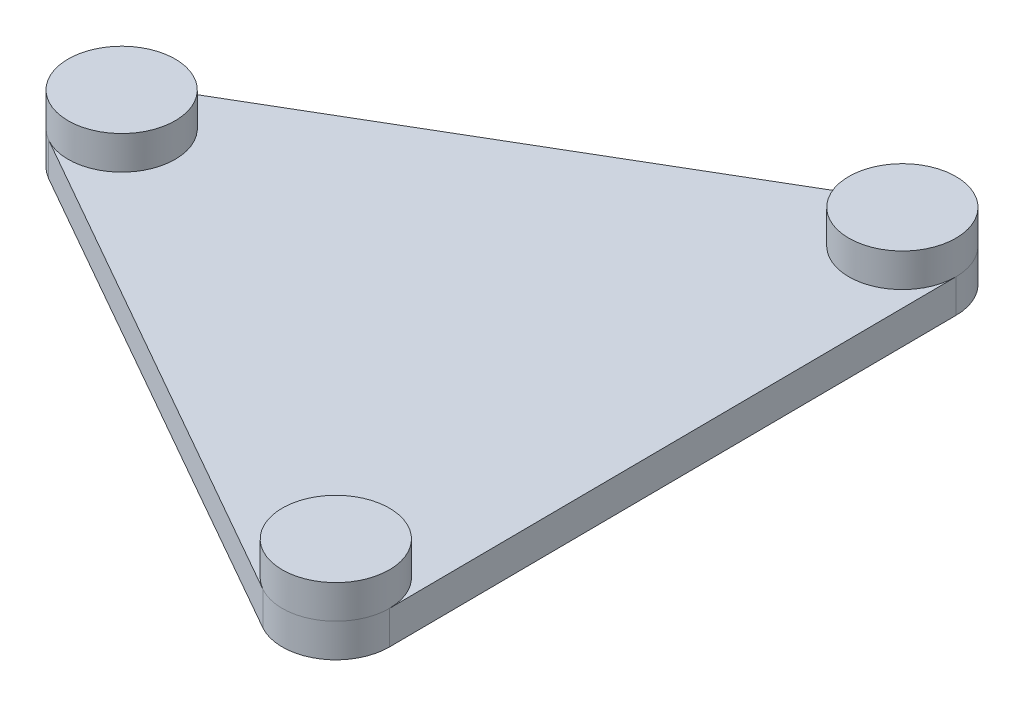
from build123d import *

# Parameters (mm, degrees)
BOSS_EXTRUDE1_DEPTH = 6.35
SKETCH2_R           = 10.16
BOSS_EXTRUDE2_DEPTH = 6.35
FILLET1_R           = 10.16


with BuildPart() as part:
    # Sketch1 → Boss-Extrude1 (new body)
    with BuildSketch(Plane(origin=(0, 0, 0), x_dir=(1, 0, 0), z_dir=(0, 1, 0))):
        Polygon((40.933013594, 72.038381655), (-82.853575358, -0.570161201), (41.920561763, -71.468220453), align=None)
    extrude(amount=BOSS_EXTRUDE1_DEPTH)

    # Sketch2 → Boss-Extrude2 (add)
    with BuildSketch(Plane(origin=(0, 6.35, 0), x_dir=(1, 0, 0), z_dir=(0, 1, 0))):
        with Locations(Location((-62.534056475, -0.430331372, 0), (0, 0, 120.394277672))):
            Circle(SKETCH2_R)
        with Locations(Location((30.894350337, 54.371247195, 0), (0, 0, 120.394277672))):
            Circle(SKETCH2_R)
        with Locations(Location((31.639706138, -53.940915823, 0), (0, 0, 0.394277672))):
            Circle(SKETCH2_R)
    extrude(amount=BOSS_EXTRUDE2_DEPTH)

    # Fillet1
    fillet1_edges = [part.edges().sort_by_distance(p)[0] for p in [
        (40.933013594, 3.175, -72.038381655),
        (41.920561763, 3.175, 71.468220453),
        (-82.853575358, 3.175, 0.570161201),
    ]]
    fillet(fillet1_edges, radius=FILLET1_R - 0.0001)  # a hair under: the kernel refuses the full size


solid = part.part
